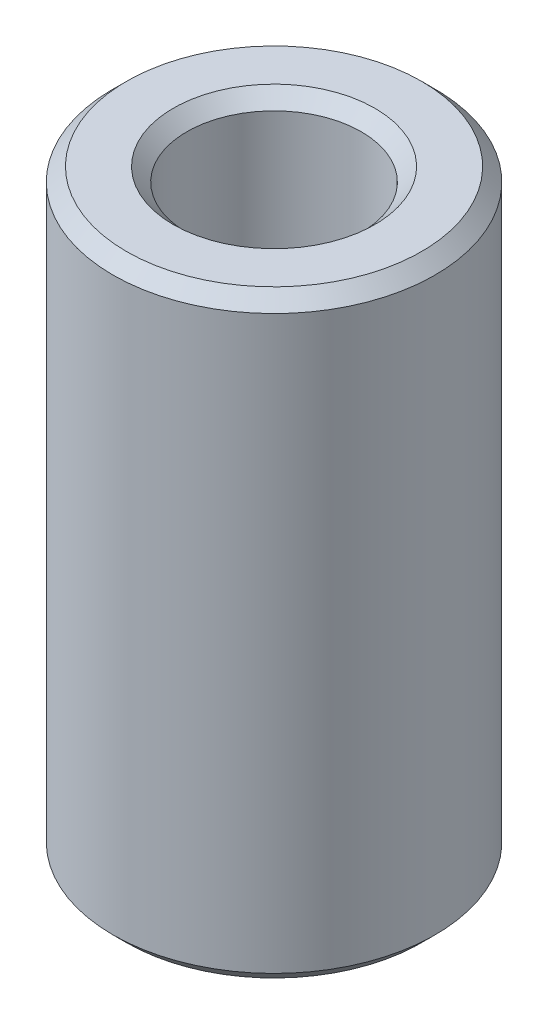
from build123d import *

# Parameters (mm, degrees)
SKETCH1_R           = 12.5
BOSS_EXTRUDE1_DEPTH = 46.453723056
SKETCH2_R           = 6.771577992
CUT_EXTRUDE1_DEPTH  = 50.703605359
CHAMFER1_SIZE       = 1.051935009


with BuildPart() as part:
    # Sketch1 → Boss-Extrude1 (new body)
    with BuildSketch(Plane(origin=(0, 0, 0), x_dir=(1, 0, 0), z_dir=(0, 1, 0))):
        Circle(SKETCH1_R)
    extrude(amount=BOSS_EXTRUDE1_DEPTH)

    # Sketch2 → Cut-Extrude1 (cut, through all)
    with BuildSketch(Plane(origin=(0, 0, 0), x_dir=(1, 0, 0), z_dir=(0, 1, 0))):
        Circle(SKETCH2_R)
    extrude(amount=CUT_EXTRUDE1_DEPTH, mode=Mode.SUBTRACT)

    # Chamfer1
    chamfer1_edges = [part.edges().sort_by_distance(p)[0] for p in [
        (-6.771577992, 46.453723056, 0),
        (-6.771577992, 0, 0),
        (-12.5, 0, 0),
        (-12.5, 46.453723056, 0),
    ]]
    chamfer(chamfer1_edges, length=CHAMFER1_SIZE)


solid = part.part
